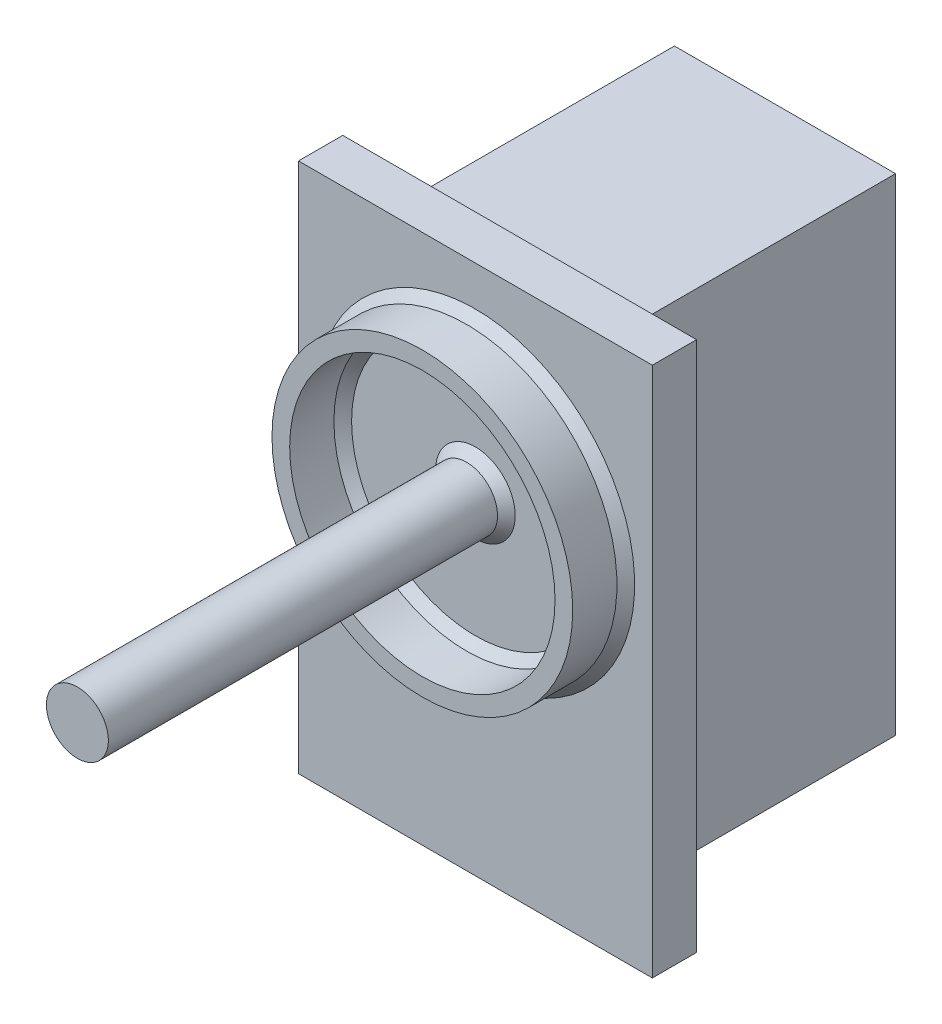
from build123d import *

# Parameters (mm, degrees)
SKETCH_1_W          = 25
SKETCH_1_H          = 55
EXTRUDE_1_DEPTH     = 35
SKETCH_2_W          = 20
SKETCH_2_H          = 40.5
CUT_EXTRUDE_1_DEPTH = 31.5
SKETCH_3_R          = 3.5
EXTRUDE_2_DEPTH     = 45
SKETCH_4_R          = 17
SKETCH_4_R_2        = 15
EXTRUDE_3_DEPTH     = 6
SKETCH_5_W          = 40
SKETCH_5_H          = 60
EXTRUDE_4_DEPTH     = 5
CHAMFER_1_SIZE      = 1
CHAMFER_2_SIZE      = 1


with BuildPart() as part:
    # 草圖1 → 填料-伸長1 (new body)
    with BuildSketch(Plane.XY):
        Rectangle(SKETCH_1_W, SKETCH_1_H)
    extrude(amount=EXTRUDE_1_DEPTH)

    # 草圖2 → 除料-伸長1 (cut)
    with BuildSketch(Plane(origin=(0, 0, 0), x_dir=(-1, 0, 0), z_dir=(0, 0, -1))):
        Rectangle(SKETCH_2_W, SKETCH_2_H)
    extrude(amount=-CUT_EXTRUDE_1_DEPTH, mode=Mode.SUBTRACT)

    # 草圖3 → 填料-伸長2 (add)
    with BuildSketch(Plane.XY.offset(35)):
        with Locations((0, 7.5)):
            Circle(SKETCH_3_R)
    extrude(amount=EXTRUDE_2_DEPTH)

    # 草圖4 → 填料-伸長3 (add)
    with BuildSketch(Plane.XY.offset(35)):
        with Locations((0, 7.5)):
            Circle(SKETCH_4_R)
        with Locations((0, 7.5)):
            Circle(SKETCH_4_R_2, mode=Mode.SUBTRACT)
    extrude(amount=EXTRUDE_3_DEPTH)

    # 草圖5 → 填料-伸長4 (add)
    with BuildSketch(Plane.XY.offset(35)):
        Rectangle(SKETCH_5_W, SKETCH_5_H)
    extrude(amount=-EXTRUDE_4_DEPTH)

    # 導角1
    chamfer_1_edges = [part.edges().sort_by_distance(p)[0] for p in [
        (-3.5, 7.5, 35),
        (-15, 7.5, 35),
        (-17, 7.5, 35),
    ]]
    chamfer(chamfer_1_edges, length=CHAMFER_1_SIZE)

    # 導角2
    chamfer_2_edges = [part.edges().sort_by_distance(p)[0] for p in [
        (0, 27.5, 30),
        (12.5, 0, 30),
        (0, -27.5, 30),
        (-12.5, 0, 30),
    ]]
    chamfer(chamfer_2_edges, length=CHAMFER_2_SIZE)


solid = part.part
